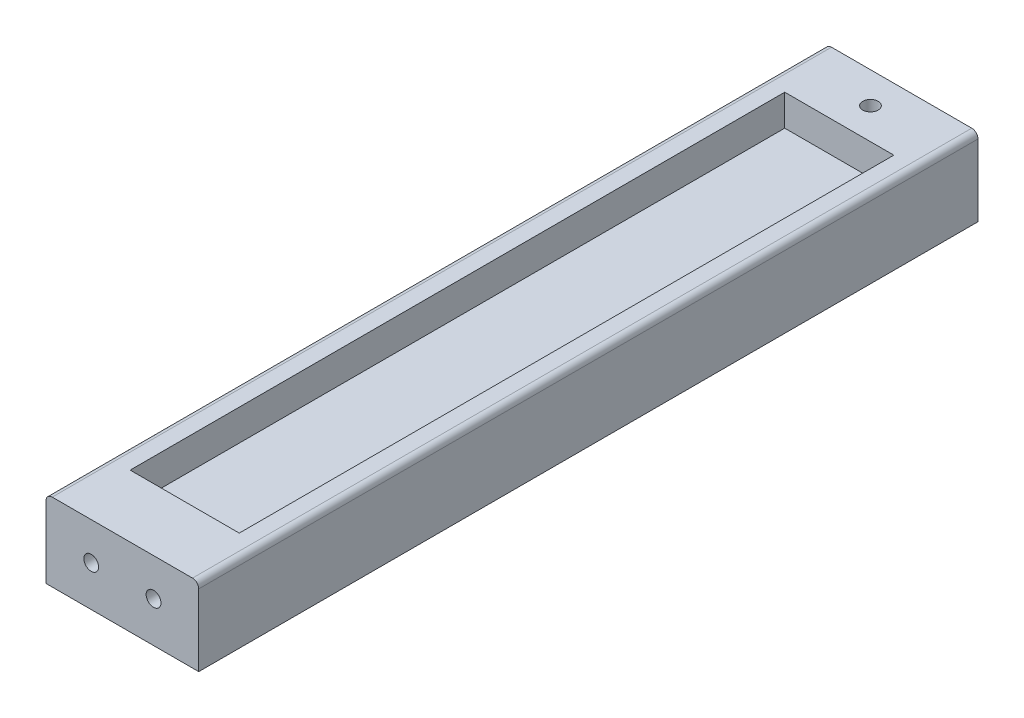
from build123d import *

# Parameters (mm, degrees)
SKETCH1_W               = 49
SKETCH1_H               = 20
BOSS_EXTRUDE1_DEPTH     = 125
SKETCH3_W               = 49
SKETCH3_H               = 250
BOSS_EXTRUDE2_DEPTH     = 5
CUT_EXTRUDE1_DEPTH      = 130.808512818
CUT_EXTRUDE1_DEPTH_BACK = 10
SKETCH2_R               = 2.46
SKETCH5_W               = 35
SKETCH5_H               = 210
CUT_EXTRUDE3_DEPTH      = 10
FILLET1_R               = 2
SKETCH4_R               = 7.874
CUT_EXTRUDE2_DEPTH      = 10
SKETCH6_R               = 2.375
CUT_EXTRUDE4_DEPTH      = 10


with BuildPart() as part:
    # Sketch1 → Boss-Extrude1 (new, symmetric)
    with BuildSketch(Plane.XY):
        Rectangle(SKETCH1_W, SKETCH1_H)
    extrude(amount=BOSS_EXTRUDE1_DEPTH, both=True)

    # Sketch3 → Boss-Extrude2 (add)
    with BuildSketch(Plane(origin=(0, 10, 0), x_dir=(1, 0, 0), z_dir=(0, 1, 0))):
        Rectangle(SKETCH3_W, SKETCH3_H)
    extrude(amount=BOSS_EXTRUDE2_DEPTH)

    # Sketch2 → Cut-Extrude1 (cut, two sides: drawn at the far end of the back side and taken through both)
    with BuildSketch(Plane(origin=(0, 15, 0), x_dir=(1, 0, 0), z_dir=(0, 1, 0)).offset(-CUT_EXTRUDE1_DEPTH_BACK)):
        with Locations((0, 115)):
            Circle(SKETCH2_R)
    extrude(amount=CUT_EXTRUDE1_DEPTH + CUT_EXTRUDE1_DEPTH_BACK, mode=Mode.SUBTRACT)

    # Sketch5 → Cut-Extrude3 (cut)
    with BuildSketch(Plane(origin=(0, 15, 0), x_dir=(1, 0, 0), z_dir=(0, 1, 0))):
        Rectangle(SKETCH5_W, SKETCH5_H)
    extrude(amount=-CUT_EXTRUDE3_DEPTH, mode=Mode.SUBTRACT)

    # Fillet1
    fillet1_edges = [part.edges().sort_by_distance(p)[0] for p in [
        (-24.5, 15, 0),
        (24.5, 15, 0),
    ]]
    fillet(fillet1_edges, radius=FILLET1_R)

    # Sketch4 → Cut-Extrude2 (cut)
    with BuildSketch(Plane.XZ.offset(10)):
        with Locations((-0.5, 110)):
            Circle(SKETCH4_R)
    extrude(amount=-CUT_EXTRUDE2_DEPTH, mode=Mode.SUBTRACT)

    # Sketch6 → Cut-Extrude4 (cut)
    with BuildSketch(Plane.XY.offset(125)):
        with Locations((10, 3)):
            Circle(SKETCH6_R)
        with Locations((-10, 3)):
            Circle(SKETCH6_R)
    extrude(amount=-CUT_EXTRUDE4_DEPTH, mode=Mode.SUBTRACT)


solid = part.part
